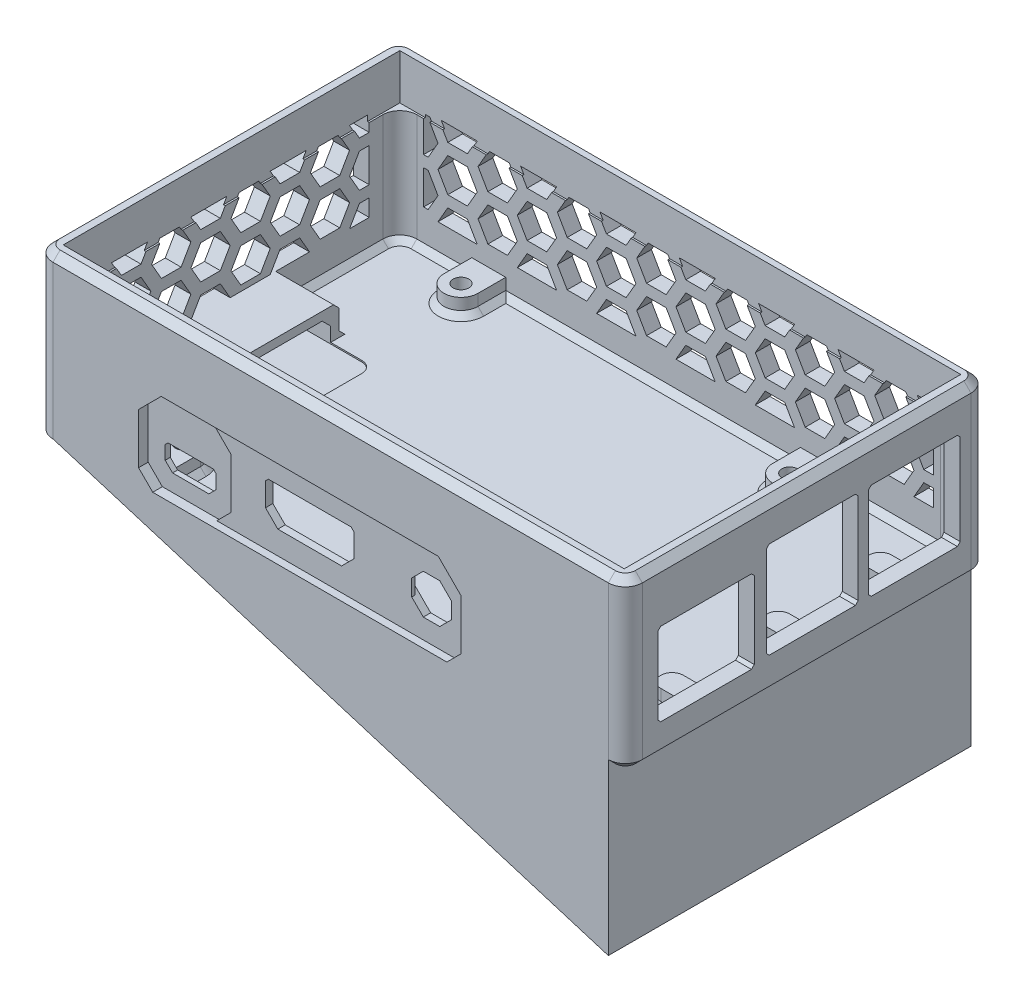
from build123d import *

# Parameters (mm, degrees)
SKETCH2_R               = 1.375
BOSS_EXTRUDE1_DEPTH     = 4.5
BOSS_EXTRUDE1_2_DEPTH   = 4.5
BOSS_EXTRUDE1_3_DEPTH   = 4.5
BOSS_EXTRUDE1_4_DEPTH   = 4.5
SKETCH4_W               = 104
SKETCH4_H               = 64
BOSS_EXTRUDE2_DEPTH     = 1.5
SKETCH5_R               = 2.6
CUT_EXTRUDE1_DEPTH      = 2.5
SKETCH6_W               = 104
SKETCH6_H               = 64
SKETCH6_W_2             = 99
SKETCH6_H_2             = 59.4
BOSS_EXTRUDE3_DEPTH     = 28
BOSS_EXTRUDE4_DEPTH     = 3
SKETCH18_W              = 99
SKETCH18_H              = 59.4
SKETCH18_W_2            = 98.4
SKETCH18_H_2            = 58.8
BOSS_EXTRUDE6_DEPTH     = 20
CUT_EXTRUDE8_DEPTH      = 2.6
CUT_EXTRUDE9_DEPTH      = 10
CUT_EXTRUDE2_DEPTH      = 121.292352209
SKETCH9_W               = 17
SKETCH9_H               = 14.6
SKETCH9_W_2             = 16.2
SKETCH9_H_2             = 17
CUT_EXTRUDE3_DEPTH      = 121.292352209
SKETCH11_W              = 56.9
SKETCH11_H              = 13.9
CUT_EXTRUDE4_DEPTH      = 1.3
SKETCH12_W              = 15
SKETCH12_H              = 13.9
CUT_EXTRUDE5_DEPTH      = 0.4
FILLET1_R               = 3
CHAMFER5_SIZE           = 2.5
CHAMFER1_SIZE           = 0.5
SKETCH20_W              = 13
SKETCH20_H              = 17
BOSS_EXTRUDE7_DEPTH     = 5.5
CHAMFER7_SIZE           = 1.25
CHAMFER3_SIZE           = 1
CUT_EXTRUDE6_DEPTH      = 4
CUT_EXTRUDE6_DEPTH_BACK = 120.933314805
CHAMFER9_SIZE           = 1.5
CHAMFER10_SIZE          = 0.7
BOSS_EXTRUDE10_DEPTH    = 64
CUT_EXTRUDE11_START     = -64
SKETCH28_R              = 1.375
CUT_EXTRUDE11_DEPTH     = 64


with BuildPart() as part:
    # Sketch2 → Boss-Extrude1 (new body)
    with BuildSketch(Plane(origin=(0, 0, 0), x_dir=(1, 0, 0), z_dir=(0, 1, 0))):
        with BuildLine():
            Line((-84.5, -2.5), (-84.5, 3.5))
            ThreePointArc((-84.5, 3.5), (-81.5, 6.5), (-78.5, 3.5))
            Line((-78.5, 3.5), (-78.5, -2.5))
            Line((-78.5, -2.5), (-84.5, -2.5))
        make_face()
        with Locations(Location((-81.5, 3.5, 0), (0, 0, 270))):
            Circle(SKETCH2_R, mode=Mode.SUBTRACT)
    extrude(amount=BOSS_EXTRUDE1_DEPTH)



with BuildPart() as body_2:
    # Sketch2 → Boss-Extrude1 2 (new body)
    with BuildSketch(Plane(origin=(0, 0, 0), x_dir=(1, 0, 0), z_dir=(0, 1, 0))):
        with BuildLine():
            Line((-20.5, -2.5), (-26.5, -2.5))
            Line((-26.5, -2.5), (-26.5, 3.5))
            ThreePointArc((-26.5, 3.5), (-23.5, 6.5), (-20.5, 3.5))
            Line((-20.5, 3.5), (-20.5, -2.5))
        make_face()
        with Locations(Location((-23.5, 3.5, 0), (0, 0, 90))):
            Circle(SKETCH2_R, mode=Mode.SUBTRACT)
    extrude(amount=BOSS_EXTRUDE1_2_DEPTH)


with BuildPart() as body_3:
    # Sketch2 → Boss-Extrude1 3 (new body)
    with BuildSketch(Plane(origin=(0, 0, 0), x_dir=(1, 0, 0), z_dir=(0, 1, 0))):
        with BuildLine():
            Line((-20.5, 58.5), (-20.5, 52.5))
            ThreePointArc((-20.5, 52.5), (-23.5, 49.5), (-26.5, 52.5))
            Line((-26.5, 52.5), (-26.5, 58.5))
            Line((-26.5, 58.5), (-20.5, 58.5))
        make_face()
        with Locations(Location((-23.5, 52.5, 0), (0, 0, 270))):
            Circle(SKETCH2_R, mode=Mode.SUBTRACT)
    extrude(amount=BOSS_EXTRUDE1_3_DEPTH)


with BuildPart() as body_4:
    # Sketch2 → Boss-Extrude1 4 (new body)
    with BuildSketch(Plane(origin=(0, 0, 0), x_dir=(1, 0, 0), z_dir=(0, 1, 0))):
        with BuildLine():
            Line((-84.5, 58.5), (-78.5, 58.5))
            Line((-78.5, 58.5), (-78.5, 52.5))
            ThreePointArc((-78.5, 52.5), (-81.5, 49.5), (-84.5, 52.5))
            Line((-84.5, 52.5), (-84.5, 58.5))
        make_face()
        with Locations(Location((-81.5, 52.5, 0), (0, 0, 90))):
            Circle(SKETCH2_R, mode=Mode.SUBTRACT)
    extrude(amount=BOSS_EXTRUDE1_4_DEPTH)


with BuildPart() as part_1:
    add(part.part)

    add(body_2.part)  # Boss-Extrude2 merges body 2

    add(body_3.part)  # Boss-Extrude2 merges body 3

    add(body_4.part)  # Boss-Extrude2 merges body 4
    # Sketch4 → Boss-Extrude2 (add)
    with BuildSketch(Plane(origin=(0, 0, 0), x_dir=(1, 0, 0), z_dir=(0, 1, 0))):
        with Locations((-48, 28)):
            Rectangle(SKETCH4_W, SKETCH4_H)
    extrude(amount=BOSS_EXTRUDE2_DEPTH)

    # Sketch5 → Cut-Extrude1 (cut)
    with BuildSketch(Plane.XZ):
        with Locations(Location((-81.5, -3.5, 0), (0, 0, 270))):
            Circle(SKETCH5_R)
        with Locations(Location((-23.5, -3.5, 0), (0, 0, 270))):
            Circle(SKETCH5_R)
        with Locations(Location((-23.5, -52.5, 0), (0, 0, 270))):
            Circle(SKETCH5_R)
        with Locations(Location((-81.5, -52.5, 0), (0, 0, 270))):
            Circle(SKETCH5_R)
    extrude(amount=-CUT_EXTRUDE1_DEPTH, mode=Mode.SUBTRACT)

    # Sketch6 → Boss-Extrude3 (add)
    with BuildSketch(Plane(origin=(0, 1.5, 0), x_dir=(1, 0, 0), z_dir=(0, 1, 0))):
        with Locations((-48, 28)):
            Rectangle(SKETCH6_W, SKETCH6_H)
        with Locations((-48, 28)):
            Rectangle(SKETCH6_W_2, SKETCH6_H_2, mode=Mode.SUBTRACT)
    extrude(amount=BOSS_EXTRUDE3_DEPTH)

    # Sketch10 → Boss-Extrude4 (add)
    with BuildSketch(Plane(origin=(0, 1.5, 0), x_dir=(1, 0, 0), z_dir=(0, 1, 0))):
        with BuildLine():
            Line((1.5, 49), (-2, 49))
            ThreePointArc((-2, 49), (-4, 47), (-2, 45))
            Line((-2, 45), (1.5, 45))
            Line((1.5, 45), (1.5, 49))
        make_face()
        with BuildLine():
            Line((1.5, 31), (-2, 31))
            ThreePointArc((-2, 31), (-4, 29), (-2, 27))
            Line((-2, 27), (1.5, 27))
            Line((1.5, 27), (1.5, 31))
        make_face()
        with BuildLine():
            Line((1.5, 12.25), (-2, 12.25))
            ThreePointArc((-2, 12.25), (-4, 10.25), (-2, 8.25))
            Line((-2, 8.25), (1.5, 8.25))
            Line((1.5, 8.25), (1.5, 12.25))
        make_face()
    extrude(amount=BOSS_EXTRUDE4_DEPTH)

    # Sketch18 → Boss-Extrude6 (add)
    with BuildSketch(Plane(origin=(0, 1.5, 0), x_dir=(1, 0, 0), z_dir=(0, 1, 0))):
        with Locations((-48, 28)):
            Rectangle(SKETCH18_W, SKETCH18_H)
        with Locations((-48, 28)):
            Rectangle(SKETCH18_W_2, SKETCH18_H_2, mode=Mode.SUBTRACT)
    extrude(amount=BOSS_EXTRUDE6_DEPTH)

    # Sketch19 → Cut-Extrude8 (cut)
    with BuildSketch(Plane(origin=(0, 0, -60), x_dir=(-1, 0, 0), z_dir=(0, 0, -1))):
        Polygon((3, 7), (6.464101615, 7), (4.732050808, 10), (3, 10), align=None)
        Polygon((3, 18), (3, 12), (4.732050808, 12), (6.464101615, 15), (4.732050808, 18), align=None)
        Polygon((3, 22.5), (3, 20), (4.732050808, 20), (6.175426481, 22.5), align=None)
        Polygon((20.175426481, 22.5), (13.824573519, 22.5), (15.267949192, 20), (18.732050808, 20), align=None)
        Polygon((11.660254038, 16), (13.392304845, 19), (11.660254038, 22), (8.196152423, 22), (6.464101615, 19), (8.196152423, 16), align=None)
        Polygon((11.660254038, 8), (13.392304845, 11), (11.660254038, 14), (8.196152423, 14), (6.464101615, 11), (8.196152423, 8), align=None)
        Polygon((15.267949192, 12), (18.732050808, 12), (20.464101615, 15), (18.732050808, 18), (15.267949192, 18), (13.535898385, 15), align=None)
        Polygon((15.267949192, 10), (13.535898385, 7), (20.464101615, 7), (18.732050808, 10), align=None)
        Polygon((25.660254038, 8), (27.392304845, 11), (25.660254038, 14), (22.196152423, 14), (20.464101615, 11), (22.196152423, 8), align=None)
        Polygon((29.267949192, 10), (27.535898385, 7), (34.464101615, 7), (32.732050808, 10), align=None)
        Polygon((39.660254038, 8), (41.392304845, 11), (39.660254038, 14), (36.196152423, 14), (34.464101615, 11), (36.196152423, 8), align=None)
        Polygon((43.267949192, 10), (41.535898385, 7), (48.464101615, 7), (46.732050808, 10), align=None)
        Polygon((53.660254038, 8), (55.392304845, 11), (53.660254038, 14), (50.196152423, 14), (48.464101615, 11), (50.196152423, 8), align=None)
        Polygon((57.267949192, 10), (55.535898385, 7), (62.464101615, 7), (60.732050808, 10), align=None)
        Polygon((67.660254038, 8), (69.392304845, 11), (67.660254038, 14), (64.196152423, 14), (62.464101615, 11), (64.196152423, 8), align=None)
        Polygon((71.267949192, 10), (69.535898385, 7), (76.464101615, 7), (74.732050808, 10), align=None)
        Polygon((81.660254038, 8), (83.392304845, 11), (81.660254038, 14), (78.196152423, 14), (76.464101615, 11), (78.196152423, 8), align=None)
        Polygon((85.267949192, 10), (83.535898385, 7), (90.464101615, 7), (88.732050808, 10), align=None)
        Polygon((92.196152423, 8), (93, 8), (93, 14), (92.196152423, 14), (90.464101615, 11), align=None)
        Polygon((92.196152423, 16), (93, 16), (93, 22), (92.196152423, 22), (90.464101615, 19), align=None)
        Polygon((90.175426481, 22.5), (83.824573519, 22.5), (85.267949192, 20), (88.732050808, 20), align=None)
        Polygon((85.267949192, 12), (88.732050808, 12), (90.464101615, 15), (88.732050808, 18), (85.267949192, 18), (83.535898385, 15), align=None)
        Polygon((81.660254038, 16), (83.392304845, 19), (81.660254038, 22), (78.196152423, 22), (76.464101615, 19), (78.196152423, 16), align=None)
        Polygon((76.175426481, 22.5), (69.824573519, 22.5), (71.267949192, 20), (74.732050808, 20), align=None)
        Polygon((71.267949192, 12), (74.732050808, 12), (76.464101615, 15), (74.732050808, 18), (71.267949192, 18), (69.535898385, 15), align=None)
        Polygon((67.660254038, 16), (69.392304845, 19), (67.660254038, 22), (64.196152423, 22), (62.464101615, 19), (64.196152423, 16), align=None)
        Polygon((62.175426481, 22.5), (55.824573519, 22.5), (57.267949192, 20), (60.732050808, 20), align=None)
        Polygon((57.267949192, 12), (60.732050808, 12), (62.464101615, 15), (60.732050808, 18), (57.267949192, 18), (55.535898385, 15), align=None)
        Polygon((53.660254038, 16), (55.392304845, 19), (53.660254038, 22), (50.196152423, 22), (48.464101615, 19), (50.196152423, 16), align=None)
        Polygon((48.175426481, 22.5), (41.824573519, 22.5), (43.267949192, 20), (46.732050808, 20), align=None)
        Polygon((34.175426481, 22.5), (27.824573519, 22.5), (29.267949192, 20), (32.732050808, 20), align=None)
        Polygon((25.660254038, 16), (27.392304845, 19), (25.660254038, 22), (22.196152423, 22), (20.464101615, 19), (22.196152423, 16), align=None)
        Polygon((29.267949192, 12), (32.732050808, 12), (34.464101615, 15), (32.732050808, 18), (29.267949192, 18), (27.535898385, 15), align=None)
        Polygon((39.660254038, 16), (41.392304845, 19), (39.660254038, 22), (36.196152423, 22), (34.464101615, 19), (36.196152423, 16), align=None)
        Polygon((43.267949192, 12), (46.732050808, 12), (48.464101615, 15), (46.732050808, 18), (43.267949192, 18), (41.535898385, 15), align=None)
    extrude(amount=-CUT_EXTRUDE8_DEPTH, mode=Mode.SUBTRACT)

    # Sketch21 → Cut-Extrude9 (cut)
    with BuildSketch(Plane.ZY.offset(100)):
        Polygon((-50.267949192, 10), (-52, 10), (-52, 7), (-48.535898385, 7), align=None)
        Polygon((-50.267949192, 18), (-52, 18), (-52, 12), (-50.267949192, 12), (-48.535898385, 15), align=None)
        Polygon((-48.824573519, 22.5), (-52, 22.5), (-52, 20), (-50.267949192, 20), align=None)
        Polygon((-43.339745962, 16), (-41.607695155, 19), (-43.339745962, 22), (-46.803847577, 22), (-48.535898385, 19), (-46.803847577, 16), align=None)
        Polygon((-34.824573519, 22.5), (-41.175426481, 22.5), (-39.732050808, 20), (-36.267949192, 20), align=None)
        Polygon((-29.339745962, 16), (-27.607695155, 19), (-29.339745962, 22), (-32.803847577, 22), (-34.535898385, 19), (-32.803847577, 16), align=None)
        Polygon((-20.824573519, 22.5), (-27.175426481, 22.5), (-25.732050808, 20), (-22.267949192, 20), align=None)
        Polygon((-6.824573519, 22.5), (-13.175426481, 22.5), (-11.732050808, 20), (-8.267949192, 20), align=None)
        Polygon((-4, 16), (-4, 22), (-4.803847577, 22), (-6.535898385, 19), (-4.803847577, 16), align=None)
        Polygon((-4, 8), (-4, 14), (-4.803847577, 14), (-6.535898385, 11), (-4.803847577, 8), align=None)
        Polygon((-11.732050808, 10), (-13.464101615, 7), (-6.535898385, 7), (-8.267949192, 10), align=None)
        Polygon((-25.732050808, 10), (-27.464101615, 7), (-20.535898385, 7), (-22.267949192, 10), align=None)
        Polygon((-39.732050808, 10), (-41.464101615, 7), (-34.535898385, 7), (-36.267949192, 10), align=None)
        Polygon((-43.339745962, 8), (-41.607695155, 11), (-43.339745962, 14), (-46.803847577, 14), (-48.535898385, 11), (-46.803847577, 8), align=None)
        Polygon((-34.535898385, 15), (-36.267949192, 18), (-39.732050808, 18), (-41.464101615, 15), (-39.732050808, 12), (-36.267949192, 12), align=None)
        Polygon((-29.339745962, 8), (-27.607695155, 11), (-29.339745962, 14), (-32.803847577, 14), (-34.535898385, 11), (-32.803847577, 8), align=None)
        Polygon((-20.535898385, 15), (-22.267949192, 18), (-25.732050808, 18), (-27.464101615, 15), (-25.732050808, 12), (-22.267949192, 12), align=None)
        Polygon((-15.339745962, 8), (-13.607695155, 11), (-15.339745962, 14), (-18.803847577, 14), (-20.535898385, 11), (-18.803847577, 8), align=None)
        Polygon((-6.535898385, 15), (-8.267949192, 18), (-11.732050808, 18), (-13.464101615, 15), (-11.732050808, 12), (-8.267949192, 12), align=None)
        Polygon((-15.339745962, 16), (-13.607695155, 19), (-15.339745962, 22), (-18.803847577, 22), (-20.535898385, 19), (-18.803847577, 16), align=None)
    extrude(amount=-CUT_EXTRUDE9_DEPTH, mode=Mode.SUBTRACT)

    # Sketch8 → Cut-Extrude2 (cut, through all)
    with BuildSketch(Plane.XY):
        Polygon((-60.8, 12.8), (-45.2, 12.8), (-45.2, 8.175735931), (-47.375735931, 6), (-58.624264069, 6), (-60.8, 8.175735931), align=None)
        Polygon((-78.9, 9.1), (-69.9, 9.1), (-69.9, 6.192893219), (-71.192893219, 4.9), (-77.607106781, 4.9), (-78.9, 6.192893219), align=None)
        Polygon((-28, 10.349747468), (-30.050252532, 12.4), (-32.949747468, 12.4), (-35, 10.349747468), (-35, 7.450252532), (-32.949747468, 5.4), (-30.050252532, 5.4), (-28, 7.450252532), align=None)
    extrude(amount=CUT_EXTRUDE2_DEPTH, mode=Mode.SUBTRACT)

    # Sketch9 → Cut-Extrude3 (cut, through all)
    with BuildSketch(Plane(origin=(0, 0, 0), x_dir=(0, 0, -1), z_dir=(1, 0, 0))):
        with Locations((10.25, 12.7)):
            Rectangle(SKETCH9_W, SKETCH9_H)
        with Locations((29, 14.5)):
            Rectangle(SKETCH9_W_2, SKETCH9_H_2)
        with Locations((47, 14.5)):
            Rectangle(SKETCH9_W_2, SKETCH9_H_2)
    extrude(amount=CUT_EXTRUDE3_DEPTH, mode=Mode.SUBTRACT)

    # Sketch11 → Cut-Extrude4 (cut)
    with BuildSketch(Plane.XY.offset(4)):
        with Locations((-53.45, 8.85)):
            Rectangle(SKETCH11_W, SKETCH11_H)
    extrude(amount=-CUT_EXTRUDE4_DEPTH, mode=Mode.SUBTRACT)

    # Sketch12 → Cut-Extrude5 (cut)
    with BuildSketch(Plane.XY.offset(2.7)):
        with Locations((-74.4, 8.85)):
            Rectangle(SKETCH12_W, SKETCH12_H)
    extrude(amount=-CUT_EXTRUDE5_DEPTH, mode=Mode.SUBTRACT)

    # Fillet1
    fillet1_edges = [part_1.edges().sort_by_distance(p)[0] for p in [
        (-100, 14.75, -60),
        (4, 14.75, -60),
        (-100, 14.75, 4),
        (4, 14.75, 4),
        (1.2, 11.5, 1.4),
        (1.2, 11.5, -57.4),
        (-97.2, 11.5, -57.4),
        (-97.2, 11.5, 1.4),
    ]]
    fillet(fillet1_edges, radius=FILLET1_R)

    # Chamfer5
    chamfer5_edges = [part_1.edges().sort_by_distance(p)[0] for p in [
        (-81.9, 1.9, 3.15),
        (-81.9, 15.8, 3.15),
        (-25, 15.8, 3.35),
        (-25, 1.9, 3.35),
        (-66.9, 15.8, 2.5),
        (-66.9, 1.9, 2.5),
    ]]
    chamfer(chamfer5_edges, length=CHAMFER5_SIZE)

    # Chamfer1
    chamfer1_edges = [part_1.edges().sort_by_distance(p)[0] for p in [
        (2.6, 20, -18.75),
        (2.6, 20, -1.75),
        (2.6, 5.4, -1.75),
        (2.6, 5.4, -18.75),
        (2.75, 23, -37.1),
        (2.75, 23, -20.9),
        (2.6, 6, -20.9),
        (2.6, 6, -37.1),
        (2.75, 23, -55.1),
        (2.75, 23, -38.9),
        (2.6, 6, -38.9),
        (2.558595215, 6, -55.1),
        (-45.2, 12.8, 2.05),
        (-60.8, 12.8, 2.05),
        (-69.9, 9.1, 1.85),
        (-78.9, 9.1, 1.85),
    ]]
    chamfer(chamfer1_edges, length=CHAMFER1_SIZE)

    # Sketch20 → Boss-Extrude7 (add)
    with BuildSketch(Plane(origin=(0, 1.5, 0), x_dir=(1, 0, 0), z_dir=(0, 1, 0))):
        with Locations((-93.5, 28)):
            Rectangle(SKETCH20_W, SKETCH20_H)
    extrude(amount=BOSS_EXTRUDE7_DEPTH)

    # Chamfer7
    chamfer7_edges = [part_1.edges().sort_by_distance(p)[0] for p in [
        (-100, 0, -28),
        (-100, 29.5, -28),
        (-48, 0, -60),
        (4, 0, -28),
        (-48, 0, 4),
        (3.121320344, 0, 3.121320344),
        (-99.121320344, 0, 3.121320344),
        (3.121320344, 0, -59.121320344),
        (-99.121320344, 0, -59.121320344),
        (-48, 29.5, -60),
        (-48, 29.5, 4),
        (4, 29.5, -28),
        (3.121320344, 29.5, 3.121320344),
        (-99.121320344, 29.5, 3.121320344),
        (3.121320344, 29.5, -59.121320344),
        (-99.121320344, 29.5, -59.121320344),
    ]]
    chamfer(chamfer7_edges, length=CHAMFER7_SIZE)

    # Chamfer3
    chamfer3_edges = [part_1.edges().sort_by_distance(p)[0] for p in [
        (-89.35, 1.5, 1.4),
        (1.2, 1.5, -4.925),
        (-11.15, 1.5, -57.4),
        (-97.2, 1.5, -45.45),
        (-96.321320344, 1.5, 0.521320344),
        (-96.321320344, 1.5, -56.521320344),
        (0.321320344, 1.5, -56.521320344),
        (0.321320344, 1.5, 0.521320344),
        (-0.4, 1.5, -45),
        (-4, 1.5, -47),
        (-0.4, 1.5, -27),
        (-4, 1.5, -29),
        (-97.2, 1.5, -10.55),
        (-92.1, 1.5, -19.5),
        (-92.1, 1.5, -36.5),
        (-92.1, 7, -36.5),
        (-92.1, 7, -19.5),
        (-0.4, 1.5, -8.25),
        (-4, 1.5, -10.25),
        (-84.5, 1.5, -1.05),
        (-0.4, 1.5, -12.25),
        (-81.5, 1.5, -6.5),
        (-0.4, 1.5, -31),
        (-0.4, 1.5, -49),
        (-78.5, 1.5, -54.95),
        (-20.5, 1.5, -54.95),
        (-26.5, 1.5, -1.05),
        (-78.5, 1.5, -1.05),
        (-52.5, 1.5, 1.4),
        (-89.35, 1.5, -57.4),
        (-11.15, 1.5, 1.4),
        (1.2, 1.5, -51.7),
        (-52.5, 1.5, -57.4),
        (1.2, 1.5, -38),
        (1.2, 1.5, -19.625),
        (-23.5, 1.5, -6.5),
        (-20.5, 1.5, -1.05),
        (-23.5, 1.5, -49.5),
        (-26.5, 1.5, -54.95),
        (-81.5, 1.5, -49.5),
        (-84.5, 1.5, -54.95),
    ]]
    chamfer(chamfer3_edges, length=CHAMFER3_SIZE)

    # Sketch14 → Cut-Extrude6 (cut, two sides: drawn at the far end of the back side and taken through both)
    with BuildSketch(Plane(origin=(0, 1.5, 0), x_dir=(1, 0, 0), z_dir=(0, 1, 0)).offset(-CUT_EXTRUDE6_DEPTH_BACK)):
        with BuildLine():
            Line((-79.5, 33), (-79.5, 23))
            ThreePointArc((-79.5, 23), (-80.085786438, 21.585786438), (-81.5, 21))
            Line((-81.5, 21), (-100, 21))
            Line((-100, 21), (-100, 35))
            Line((-100, 35), (-81.5, 35))
            ThreePointArc((-81.5, 35), (-80.085786438, 34.414213562), (-79.5, 33))
        make_face()
    extrude(amount=CUT_EXTRUDE6_DEPTH + CUT_EXTRUDE6_DEPTH_BACK, mode=Mode.SUBTRACT)

    # Chamfer9
    # the kernel refuses this chamfer: 1.5 mm, written as the material it adds along each edge
    with BuildSketch(Plane(origin=(-87, 5.5, -21), x_dir=(0, -0.9996219169112968, 0.027495876610586775), z_dir=(-1, 0, 0)), Plane(origin=(-100, 5.5, -35), x_dir=(0, -0.9996219169112968, -0.027495876610586775), z_dir=(1, 0, 0))) as chamfer9_piece_1:
        Polygon((CHAMFER9_SIZE * 0.999621916911, -CHAMFER9_SIZE * 0.0274958766106), (-CHAMFER9_SIZE * 0.0274958766106, -CHAMFER9_SIZE * 0.999621916911), (0, 0), align=None)
    extrude(amount=13)
    # the kernel refuses this chamfer: 1.5 mm, written as the material it takes off along each edge
    with BuildSketch(Plane(origin=(-83.257524482, 15.8, 4), x_dir=(0, 0.9996219169112968, 0.027495876610586223), z_dir=(1, 0, 0))) as chamfer9_2_piece_1_section:
        Polygon((CHAMFER9_SIZE * 0.999621916911, -CHAMFER9_SIZE * 0.0274958766106), (-CHAMFER9_SIZE * 0.0274958766106, -CHAMFER9_SIZE * 0.999621916911), (0, 0), align=None)
    chamfer9_2_piece_1 = extrude(amount=59.615048964, mode=Mode.PRIVATE)
    chamfer9_2_piece_1 = split(chamfer9_2_piece_1, bisect_by=Plane(origin=(-74.4, 16.276865215, 2.7), z_dir=(0, 0, 1)), keep=Keep.TOP, mode=Mode.PRIVATE)
    chamfer9_2_piece_1 = split(chamfer9_2_piece_1, bisect_by=Plane(origin=(-76.661567393, 18.538432607, 3.516149063), z_dir=(0.7071067811865476, -0.7071067811865476, 0)), keep=Keep.TOP, mode=Mode.PRIVATE)
    chamfer9_2_piece_1 = split(chamfer9_2_piece_1, bisect_by=Plane(origin=(-72.138432607, 18.538432607, 3.516149063), z_dir=(-0.7071067811865476, -0.7071067811865476, 0)), keep=Keep.TOP, mode=Mode.PRIVATE)
    add(chamfer9_2_piece_1, mode=Mode.SUBTRACT)
    with BuildSketch(Plane(origin=(-83.257524482, 15.8, 4), x_dir=(0, 0.9996219169112968, 0.027495876610586223), z_dir=(1, 0, 0))) as chamfer9_2_piece_2_section:
        Polygon((CHAMFER9_SIZE * 0.999621916911, -CHAMFER9_SIZE * 0.0274958766106), (-CHAMFER9_SIZE * 0.0274958766106, -CHAMFER9_SIZE * 0.999621916911), (0, 0), align=None)
    chamfer9_2_piece_2 = extrude(amount=59.615048964, mode=Mode.PRIVATE)
    chamfer9_2_piece_2 = split(chamfer9_2_piece_2, bisect_by=Plane(origin=(-74.4, 15.824226738, 2.7), z_dir=(0, 0, -1)), keep=Keep.TOP, mode=Mode.PRIVATE)
    chamfer9_2_piece_2 = split(chamfer9_2_piece_2, bisect_by=Plane(origin=(-76.887886631, 18.312113369, 2.610330737), z_dir=(0.7071067811865476, -0.7071067811865476, 0)), keep=Keep.TOP, mode=Mode.PRIVATE)
    chamfer9_2_piece_2 = split(chamfer9_2_piece_2, bisect_by=Plane(origin=(-71.912113369, 18.312113369, 2.610330737), z_dir=(-0.7071067811865476, -0.7071067811865476, 0)), keep=Keep.TOP, mode=Mode.PRIVATE)
    add(chamfer9_2_piece_2, mode=Mode.SUBTRACT)
    with BuildSketch(Plane(origin=(-83.257524482, 15.8, 4), x_dir=(0, 0.9996219169112968, 0.027495876610586223), z_dir=(1, 0, 0))) as chamfer9_2_piece_3_section:
        Polygon((CHAMFER9_SIZE * 0.999621916911, -CHAMFER9_SIZE * 0.0274958766106), (-CHAMFER9_SIZE * 0.0274958766106, -CHAMFER9_SIZE * 0.999621916911), (0, 0), align=None)
    chamfer9_2_piece_3 = extrude(amount=59.615048964, mode=Mode.PRIVATE)
    chamfer9_2_piece_3 = split(chamfer9_2_piece_3, bisect_by=Plane(origin=(-48.958114685, 16.308114685, 2.7), z_dir=(0, 0, 1)), keep=Keep.TOP, mode=Mode.PRIVATE)
    chamfer9_2_piece_3 = split(chamfer9_2_piece_3, bisect_by=Plane(origin=(-59.433114685, 5.833114685, 3.530877018), z_dir=(0.7071067811865476, 0.7071067811865476, 0)), keep=Keep.TOP, mode=Mode.PRIVATE)
    chamfer9_2_piece_3 = split(chamfer9_2_piece_3, bisect_by=Plane(origin=(-38.483114685, 26.783114685, 3.530877018), z_dir=(-0.7071067811865476, -0.7071067811865476, 0)), keep=Keep.TOP, mode=Mode.PRIVATE)
    add(chamfer9_2_piece_3, mode=Mode.SUBTRACT)

    # Chamfer10
    chamfer10_edges = [part_1.edges().sort_by_distance(p)[0] for p in [
        (-35, 8.9, 1.4),
        (-33.974873734, 11.374873734, 1.4),
        (-31.5, 12.4, 1.4),
        (-29.025126266, 11.374873734, 1.4),
    ]]
    chamfer(chamfer10_edges, length=CHAMFER10_SIZE)

    # Sketch24 → Boss-Extrude10 (add)
    with BuildSketch(Plane(origin=(0, 0, -60), x_dir=(-1, 0, 0), z_dir=(0, 0, -1))):
        Polygon((97, 1.25), (-1, -28.711606783), (-1, 1.25), align=None)
    extrude(amount=-BOSS_EXTRUDE10_DEPTH)

    # Sketch28 → Cut-Extrude11 (cut)
    with BuildSketch(Plane(origin=(0, 4.5, 0), x_dir=(1, 0, 0), z_dir=(0, 1, 0)).offset(CUT_EXTRUDE11_START)):
        with Locations(Location((-81.5, 52.5, 0), (0, 0, 90))):
            Circle(SKETCH28_R)
        with Locations(Location((-81.5, 3.5, 0), (0, 0, 90))):
            Circle(SKETCH28_R)
        with Locations(Location((-23.5, 3.5, 0), (0, 0, 90))):
            Circle(SKETCH28_R)
        with Locations(Location((-23.5, 52.5, 0), (0, 0, 90))):
            Circle(SKETCH28_R)
    extrude(amount=CUT_EXTRUDE11_DEPTH, mode=Mode.SUBTRACT)


solid = part_1.part
